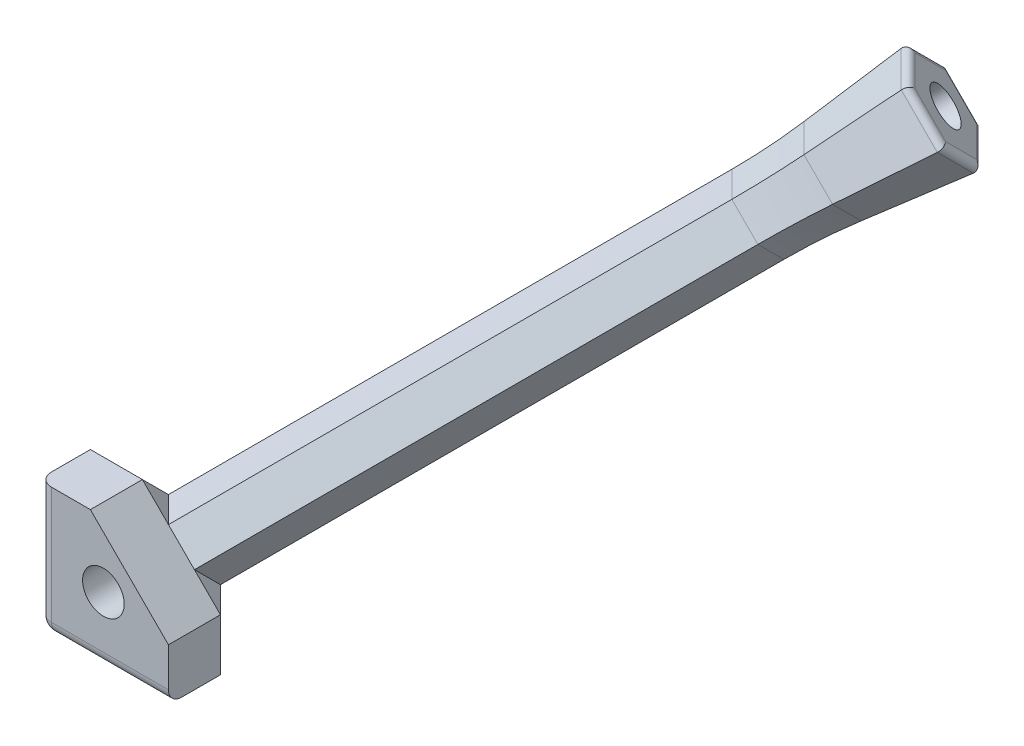
from build123d import *

# Parameters (mm, degrees)
SKETCH1_W           = 10
SKETCH1_H           = 10
BOSS_EXTRUDE1_DEPTH = 10
SKETCH2_R           = 1.6
CUT_EXTRUDE1_DEPTH  = 3.2
SKETCH3_R           = 1.6
CUT_EXTRUDE3_DEPTH  = 3.2
SKETCH4_R           = 1.6
CUT_EXTRUDE4_DEPTH  = 3.2
FILLET2_R           = 1
CHAMFER1_SIZE       = 6
BOSS_EXTRUDE2_DEPTH = 50
SKETCH6_R           = 1.475
CUT_EXTRUDE5_DEPTH  = 4.1
FILLET3_R           = 0.5
FILLET4_R           = 50


with BuildPart() as part:
    # Sketch1 → Boss-Extrude1 (new body)
    with BuildSketch(Plane(origin=(0, 0, 0), x_dir=(1, 0, 0), z_dir=(0, 1, 0))):
        Rectangle(SKETCH1_W, SKETCH1_H)
    extrude(amount=BOSS_EXTRUDE1_DEPTH)

    # Sketch2 → Cut-Extrude1 (cut)
    with BuildSketch(Plane.XY.offset(5)):
        with Locations((0, 5)):
            Circle(SKETCH2_R)
    extrude(amount=-CUT_EXTRUDE1_DEPTH, mode=Mode.SUBTRACT)

    # Sketch3 → Cut-Extrude3 (cut)
    with BuildSketch(Plane(origin=(0, 0, 0), x_dir=(-1, 0, 0), z_dir=(0, -1, 0))):
        with Locations(Location((0, 0, 0), (0, 0, 90))):
            Circle(SKETCH3_R)
    extrude(amount=-CUT_EXTRUDE3_DEPTH, mode=Mode.SUBTRACT)

    # Sketch4 → Cut-Extrude4 (cut)
    with BuildSketch(Plane(origin=(-5, 0, 0), x_dir=(0, 0, -1), z_dir=(1, 0, 0))):
        with Locations((0, 5)):
            Circle(SKETCH4_R)
    extrude(amount=CUT_EXTRUDE4_DEPTH, mode=Mode.SUBTRACT)

    # Fillet2
    fillet2_edges = [part.edges().sort_by_distance(p)[0] for p in [
        (0, 0, 5),
        (-5, 0, 0),
        (-5, 5, 5),
    ]]
    fillet(fillet2_edges, radius=FILLET2_R)

    # Chamfer1
    chamfer1_edges = [part.edges().sort_by_distance(p)[0] for p in [
        (5, 10, 0),
        (5, 5, -5),
        (0, 10, -5),
    ]]
    chamfer(chamfer1_edges, length=CHAMFER1_SIZE)

    # Sketch5 → Boss-Extrude2 (add)
    with BuildSketch(Plane(origin=(2.666666667, 2.666666667, -2.666666667), x_dir=(-0.4082482904638649, -0.4082482904638639, -0.8164965809277248), z_dir=(0.5773502691896257, 0.577350269189624, -0.5773502691896276))):
        Polygon((0.40824829, 4.949747468), (-2.041241452, 6.363961031), (-4.490731195, 4.949747468), (-4.490731195, 2.121320344), (-2.041241452, 0.707106781), (0.40824829, 2.121320344), align=None)
    extrude(amount=BOSS_EXTRUDE2_DEPTH)

    # Sketch13 → Loft3 section 0
    with BuildSketch(Plane(origin=(25.760677434, 25.760677434, -25.760677434), x_dir=(-0.8164965809277259, 0.4082482904638619, -0.4082482904638644), z_dir=(0.577350269189626, 0.577350269189624, -0.5773502691896274))):
        with BuildLine():
            Line((2.041241452, 6.363961031), (-0.40824829, 4.949747468))
            Line((-0.40824829, 4.949747468), (-0.40824829, 2.121320344))
            Line((-0.40824829, 2.121320344), (2.041241452, 0.707106781))
            Line((2.041241452, 0.707106781), (4.490731195, 2.121320344))
            Line((4.490731195, 2.121320344), (4.490731195, 4.949747468))
            Line((4.490731195, 4.949747468), (2.041241452, 6.363961031))
        make_face()
    # Sketch12 → Loft3 section 1
    with BuildSketch(Plane(origin=(31.534180126, 31.534180126, -31.534180126), x_dir=(-0.40824829046386485, -0.4082482904638636, -0.8164965809277249), z_dir=(0.577350269189626, 0.5773502691896241, -0.5773502691896275))):
        with BuildLine():
            Line((1.40824829, 1.543970074), (1.40824829, 5.527097737))
            Line((1.40824829, 5.527097737), (-2.041241452, 7.518661569))
            Line((-2.041241452, 7.518661569), (-5.490731195, 5.527097737))
            Line((-5.490731195, 5.527097737), (-5.490731195, 1.543970074))
            Line((-5.490731195, 1.543970074), (-2.041241452, -0.447593757))
            Line((-2.041241452, -0.447593757), (1.40824829, 1.543970074))
        make_face()
    loft()

    # Sketch6 → Cut-Extrude5 (cut)
    with BuildSketch(Plane(origin=(31.534180126, 31.534180126, -31.534180126), x_dir=(-0.40824829046386507, -0.4082482904638639, -0.8164965809277246), z_dir=(0.5773502691896257, 0.5773502691896238, -0.5773502691896278))):
        with Locations(Location((-2.041241452, 3.535533906, 0), (0, 0, 30))):
            Circle(SKETCH6_R)
    extrude(amount=-CUT_EXTRUDE5_DEPTH, mode=Mode.SUBTRACT)

    # Fillet3
    fillet3_edges = [part.edges().sort_by_distance(p)[0] for p in [
        (28.459265169, 37.68401004, -28.459265169),
        (31.27576175, 36.27576175, -27.051016879),
        (32.68401004, 33.459265169, -28.459265169),
        (31.27576175, 32.051016879, -31.27576175),
        (28.459265169, 33.459265169, -32.68401004),
        (27.051016879, 36.27576175, -31.27576175),
    ]]
    fillet(fillet3_edges, radius=FILLET3_R)

    # Fillet4
    # the kernel refuses this fillet: 50 mm, written as the material it adds along each edge
    with BuildSketch(Plane(origin=(30.502434506, 27.094010768, -19.685587029), x_dir=(0.6151072128065446, 0.49324054325118827, -0.6151072128065457), z_dir=(-0.7071067811865475, -1.8318679906315083e-15, -0.7071067811865477))) as fillet4_piece_1_section:
        with BuildLine():
            CenterArc((FILLET4_R * 0.0498756211209, FILLET4_R), FILLET4_R, 264.289406863, 5.710593137)
            Line((-FILLET4_R * 0.0496280979001, FILLET4_R * 0.00496280979001), (0, 0))
            Line((0, 0), (FILLET4_R * 0.0498756211209, 0))
        make_face()
    fillet4_piece_1 = extrude(amount=15.297332405, mode=Mode.PRIVATE)
    fillet4_piece_1 = fillet4_piece_1 - Plane(origin=(5.44602295, 2.037599211, -65.47905465), x_dir=(0.4636707308133369, 0.463670730813339, 0.7549959647402431), z_dir=(0.7071067811865475, -0.7071067811865478, 2.220446049250313e-15)) * Cylinder(50, 41, mode=Mode.PRIVATE)
    fillet4_piece_1 = fillet4_piece_1 - Plane(origin=(65.47905465, 7.44602295, -0.037599211), x_dir=(-0.7549959647402456, 0.4636707308133344, -0.46367073081333715), z_dir=(0, 0.7071067811865497, 0.7071067811865455)) * Cylinder(50, 41, mode=Mode.PRIVATE)
    add(fillet4_piece_1)
    with BuildSketch(Plane(origin=(26.094010768, 33.502434506, -17.685587029), x_dir=(0.6557294359916664, 0.5338627664363041, -0.5338627664363074), z_dir=(0, -0.7071067811865497, -0.7071067811865455))) as fillet4_piece_2_section:
        with BuildLine():
            CenterArc((FILLET4_R * 0.0498756211209, FILLET4_R), FILLET4_R, 264.289406863, 5.710593137)
            Line((-FILLET4_R * 0.0496280979001, FILLET4_R * 0.00496280979001), (0, 0))
            Line((0, 0), (FILLET4_R * 0.0498756211209, 0))
        make_face()
    fillet4_piece_2 = extrude(amount=15.297332405, mode=Mode.PRIVATE)
    fillet4_piece_2 = fillet4_piece_2 - Plane(origin=(42.862428257, 50.270851996, 20.170603443), x_dir=(-0.3487737328890522, -0.34877373288905417, -0.8698929626645284), z_dir=(-0.7071067811865471, 0.7071067811865479, -1.8596235662471372e-15)) * Cylinder(50, 41, mode=Mode.PRIVATE)
    fillet4_piece_2 = fillet4_piece_2 - Plane(origin=(48.270851996, -15.170603443, -39.862428257), x_dir=(-0.34877373288905117, 0.8698929626645311, 0.3487737328890489), z_dir=(0.7071067811865476, 1.831867990631508e-15, 0.7071067811865476)) * Cylinder(50, 41, mode=Mode.PRIVATE)
    add(fillet4_piece_2)
    with BuildSketch(Plane(origin=(19.685587029, 35.502434506, -22.094010768), x_dir=(0.6151072128065466, 0.6151072128065448, -0.49324054325118677), z_dir=(0.7071067811865472, -0.7071067811865479, 1.7763568394002505e-15))) as fillet4_piece_3_section:
        with BuildLine():
            CenterArc((FILLET4_R * 0.0498756211209, FILLET4_R), FILLET4_R, 264.289406863, 5.710593137)
            Line((-FILLET4_R * 0.0496280979001, FILLET4_R * 0.00496280979001), (0, 0))
            Line((0, 0), (FILLET4_R * 0.0498756211209, 0))
        make_face()
    fillet4_piece_3 = extrude(amount=15.297332405, mode=Mode.PRIVATE)
    fillet4_piece_3 = fillet4_piece_3 - Plane(origin=(0.037599211, 70.47905465, -2.44602295), x_dir=(0.46367073081333604, -0.7549959647402467, -0.4636707308133341), z_dir=(-0.7071067811865476, -1.6930901125533633e-15, -0.7071067811865477)) * Cylinder(50, 41, mode=Mode.PRIVATE)
    fillet4_piece_3 = fillet4_piece_3 - Plane(origin=(65.47905465, 10.44602295, 2.962400789), x_dir=(-0.7549959647402456, 0.4636707308133344, -0.46367073081333715), z_dir=(0, 0.7071067811865497, 0.7071067811865455)) * Cylinder(50, 41, mode=Mode.PRIVATE)
    add(fillet4_piece_3)
    with BuildSketch(Plane(origin=(17.685587029, 31.094010768, -28.502434506), x_dir=(0.533862766436308, 0.6557294359916612, -0.5338627664363096), z_dir=(0.7071067811865475, 1.7763568394002505e-15, 0.7071067811865476))) as fillet4_piece_4_section:
        with BuildLine():
            CenterArc((FILLET4_R * 0.0498756211209, FILLET4_R), FILLET4_R, 264.289406863, 5.710593137)
            Line((-FILLET4_R * 0.0496280979001, FILLET4_R * 0.00496280979001), (0, 0))
            Line((0, 0), (FILLET4_R * 0.0498756211209, 0))
        make_face()
    fillet4_piece_4 = extrude(amount=15.297332405, mode=Mode.PRIVATE)
    fillet4_piece_4 = fillet4_piece_4 - Plane(origin=(39.862428257, 53.270851996, 20.170603443), x_dir=(-0.3487737328890522, -0.34877373288905417, -0.8698929626645284), z_dir=(-0.7071067811865471, 0.7071067811865479, -1.8596235662471372e-15)) * Cylinder(50, 41, mode=Mode.PRIVATE)
    fillet4_piece_4 = fillet4_piece_4 - Plane(origin=(-20.170603443, 47.862428257, -45.270851996), x_dir=(0.8698929626645304, -0.34877373288904956, 0.3487737328890521), z_dir=(0, -0.7071067811865497, -0.7071067811865454)) * Cylinder(50, 41, mode=Mode.PRIVATE)
    add(fillet4_piece_4)
    with BuildSketch(Plane(origin=(28.502434506, 22.685587029, -26.094010768), x_dir=(0.5338627664363049, 0.5338627664363026, -0.6557294359916698), z_dir=(-0.7071067811865474, 0.7071067811865477, -2.220446049250313e-15))) as fillet4_piece_5_section:
        with BuildLine():
            CenterArc((FILLET4_R * 0.0498756211209, FILLET4_R), FILLET4_R, 264.289406863, 5.710593137)
            Line((-FILLET4_R * 0.0496280979001, FILLET4_R * 0.00496280979001), (0, 0))
            Line((0, 0), (FILLET4_R * 0.0498756211209, 0))
        make_face()
    fillet4_piece_5 = extrude(amount=15.297332405, mode=Mode.PRIVATE)
    fillet4_piece_5 = fillet4_piece_5 - Plane(origin=(45.270851996, -15.170603443, -42.862428257), x_dir=(-0.34877373288905117, 0.8698929626645311, 0.3487737328890489), z_dir=(0.7071067811865476, 1.831867990631508e-15, 0.7071067811865476)) * Cylinder(50, 41, mode=Mode.PRIVATE)
    fillet4_piece_5 = fillet4_piece_5 - Plane(origin=(-20.170603443, 44.862428257, -48.270851996), x_dir=(0.8698929626645304, -0.34877373288904956, 0.3487737328890521), z_dir=(0, -0.7071067811865497, -0.7071067811865454)) * Cylinder(50, 41, mode=Mode.PRIVATE)
    add(fillet4_piece_5)
    with BuildSketch(Plane(origin=(22.094010768, 24.685587029, -30.502434506), x_dir=(0.49324054325118744, 0.6151072128065436, -0.6151072128065473), z_dir=(0, 0.7071067811865498, 0.7071067811865454))) as fillet4_piece_6_section:
        with BuildLine():
            CenterArc((FILLET4_R * 0.0498756211209, FILLET4_R), FILLET4_R, 264.289406863, 5.710593137)
            Line((-FILLET4_R * 0.0496280979001, FILLET4_R * 0.00496280979001), (0, 0))
            Line((0, 0), (FILLET4_R * 0.0498756211209, 0))
        make_face()
    fillet4_piece_6 = extrude(amount=15.297332405, mode=Mode.PRIVATE)
    fillet4_piece_6 = fillet4_piece_6 - Plane(origin=(2.44602295, 5.037599211, -65.47905465), x_dir=(0.4636707308133369, 0.463670730813339, 0.7549959647402431), z_dir=(0.7071067811865475, -0.7071067811865478, 2.220446049250313e-15)) * Cylinder(50, 41, mode=Mode.PRIVATE)
    fillet4_piece_6 = fillet4_piece_6 - Plane(origin=(-2.962400789, 70.47905465, -5.44602295), x_dir=(0.46367073081333604, -0.7549959647402467, -0.4636707308133341), z_dir=(-0.7071067811865476, -1.6930901125533633e-15, -0.7071067811865477)) * Cylinder(50, 41, mode=Mode.PRIVATE)
    add(fillet4_piece_6)


solid = part.part
